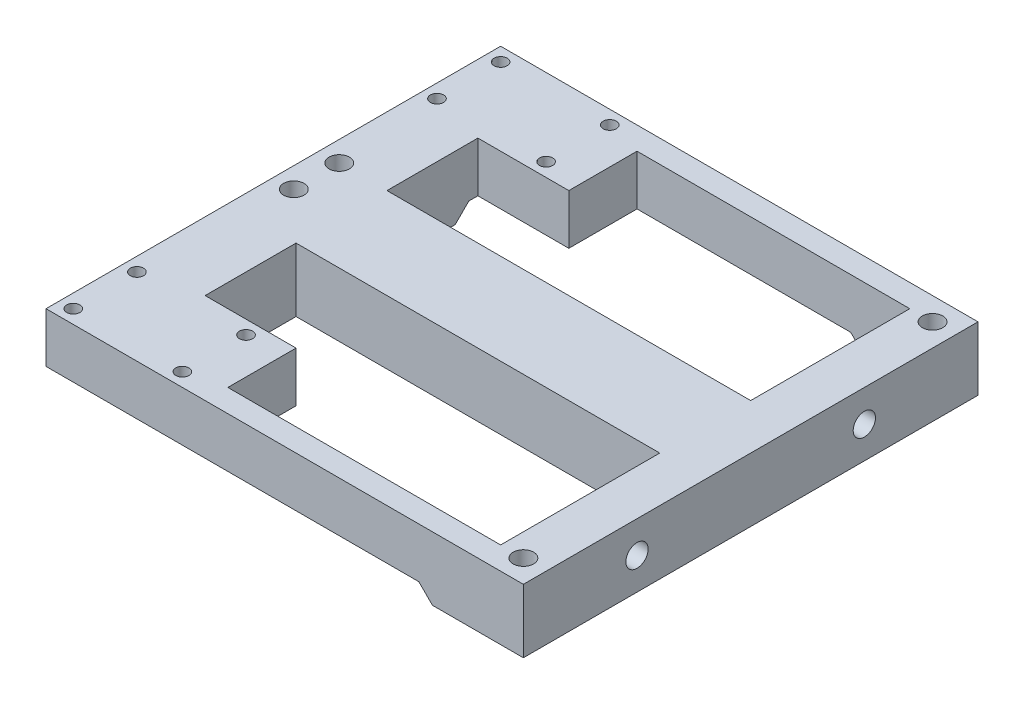
from build123d import *

# Parameters (mm, degrees)
SKETCH_1_W           = 105
SKETCH_1_H           = 100
EXTRUDE_1_DEPTH      = 16
CUT_EXTRUDE_5_REACH  = 147.88
SKETCH_8_R           = 1.45
CUT_EXTRUDE_7_DEPTH  = 146.880087743
SKETCH_9_W           = 35
SKETCH_9_H           = 16
EXTRUDE_2_DEPTH      = 5
SKETCH_10_R          = 2.25
CUT_EXTRUDE_8_DEPTH  = 5
SKETCH_12_W          = 20
SKETCH_12_H          = 16
EXTRUDE_3_DEPTH      = 10
SKETCH_13_R          = 2.25
CUT_EXTRUDE_10_DEPTH = 5
SKETCH_14_W          = 105
SKETCH_14_H          = 100
CUT_EXTRUDE_11_DEPTH = 2
SKETCH_15_R          = 1.5
CUT_EXTRUDE_12_DEPTH = 4
SKETCH_16_W          = 85
SKETCH_16_H          = 25
CUT_EXTRUDE_13_DEPTH = 3
CHAMFER_1_SIZE       = 3
SKETCH_17_R          = 2.25
CUT_EXTRUDE_14_DEPTH = 5
SKETCH_18_R          = 1.5
CUT_EXTRUDE_15_DEPTH = 4
SKETCH_21_R          = 2.45
CUT_EXTRUDE_17_DEPTH = 13.2


with BuildPart() as part:
    # 草图1 → 凸台-拉伸1 (new body)
    with BuildSketch(Plane(origin=(0, 0, 0), x_dir=(1, 0, 0), z_dir=(0, 1, 0))):
        with Locations((-52.5, 50)):
            Rectangle(SKETCH_1_W, SKETCH_1_H)
    extrude(amount=EXTRUDE_1_DEPTH)

    # 草图6 → 切除-拉伸5 (cut, up to next)
    with BuildSketch(Plane(origin=(0, 16, 0), x_dir=(1, 0, 0), z_dir=(0, 1, 0)), mode=Mode.PRIVATE) as cut_extrude_5_sk1:
        Polygon((-45.224064051, 40), (-5, 40), (-5, 5), (-70, 5), (-70, 20), (-100, 20), (-100, 40), align=None)
    cut_extrude_5_tool1 = extrude(cut_extrude_5_sk1.sketch, amount=-CUT_EXTRUDE_5_REACH, mode=Mode.PRIVATE) & part.part
    # 草图6 → 切除-拉伸5 (cut, up to next)
    with BuildSketch(Plane(origin=(0, 16, 0), x_dir=(1, 0, 0), z_dir=(0, 1, 0)), mode=Mode.PRIVATE) as cut_extrude_5_sk2:
        Polygon((-70, 95), (-5, 95), (-5, 60), (-45.224064051, 60), (-100, 60), (-100, 80), (-70, 80), align=None)
    cut_extrude_5_tool2 = extrude(cut_extrude_5_sk2.sketch, amount=-CUT_EXTRUDE_5_REACH, mode=Mode.PRIVATE) & part.part
    add(cut_extrude_5_tool1.solids().sort_by_distance((-47.413043, 16, -24.065217))[0], mode=Mode.SUBTRACT)
    add(cut_extrude_5_tool2.solids().sort_by_distance((-47.413043, 16, -75.934783))[0], mode=Mode.SUBTRACT)

    # 草图8 → 切除-拉伸7 (cut, through all)
    with BuildSketch(Plane(origin=(0, 16, 0), x_dir=(1, 0, 0), z_dir=(0, 1, 0))):
        with Locations(Location((-102, 97, 0), (0, 0, 270))):
            Circle(SKETCH_8_R)
        with Locations(Location((-102, 83, 0), (0, 0, 270))):
            Circle(SKETCH_8_R)
        with Locations(Location((-78, 97, 0), (0, 0, 270))):
            Circle(SKETCH_8_R)
        with Locations(Location((-78, 83, 0), (0, 0, 270))):
            Circle(SKETCH_8_R)
        with Locations(Location((-78, 17, 0), (0, 0, 90))):
            Circle(SKETCH_8_R)
        with Locations(Location((-78, 3, 0), (0, 0, 90))):
            Circle(SKETCH_8_R)
        with Locations(Location((-102, 17, 0), (0, 0, 90))):
            Circle(SKETCH_8_R)
        with Locations(Location((-102, 3, 0), (0, 0, 90))):
            Circle(SKETCH_8_R)
    extrude(amount=-CUT_EXTRUDE_7_DEPTH, mode=Mode.SUBTRACT)

    # 草图9 → 凸台-拉伸2 (add)
    with BuildSketch(Plane.ZY.offset(5)):
        with Locations((-22.5, 8)):
            Rectangle(SKETCH_9_W, SKETCH_9_H)
        with Locations((-77.5, 8)):
            Rectangle(SKETCH_9_W, SKETCH_9_H)
    extrude(amount=EXTRUDE_2_DEPTH)

    # 草图10 → 切除-拉伸8 (cut)
    with BuildSketch(Plane(origin=(0, 16, 0), x_dir=(1, 0, 0), z_dir=(0, 1, 0))):
        with Locations(Location((-5, 95, 0), (0, 0, 270))):
            Circle(SKETCH_10_R)
        with Locations(Location((-5, 5, 0), (0, 0, 90))):
            Circle(SKETCH_10_R)
    extrude(amount=-CUT_EXTRUDE_8_DEPTH, mode=Mode.SUBTRACT)

    # 草图12 → 凸台-拉伸3 (add)
    with BuildSketch(Plane(origin=(-100, 0, 0), x_dir=(0, 0, -1), z_dir=(1, 0, 0))):
        with Locations((30, 8)):
            Rectangle(SKETCH_12_W, SKETCH_12_H)
        with Locations((70, 8)):
            Rectangle(SKETCH_12_W, SKETCH_12_H)
    extrude(amount=EXTRUDE_3_DEPTH)

    # 草图13 → 切除-拉伸10 (cut)
    with BuildSketch(Plane(origin=(0, 16, 0), x_dir=(1, 0, 0), z_dir=(0, 1, 0))):
        with Locations(Location((-100.5, 50, 0), (0, 0, 270))):
            Circle(SKETCH_13_R)
        with Locations(Location((-100.5, 60, 0), (0, 0, 270))):
            Circle(SKETCH_13_R)
    extrude(amount=-CUT_EXTRUDE_10_DEPTH, mode=Mode.SUBTRACT)

    # 草图14 → 切除-拉伸11 (cut)
    with BuildSketch(Plane.XZ):
        with Locations((-52.5, -50)):
            Rectangle(SKETCH_14_W, SKETCH_14_H)
    extrude(amount=-CUT_EXTRUDE_11_DEPTH, mode=Mode.SUBTRACT)

    # 草图15 → 切除-拉伸12 (cut)
    with BuildSketch(Plane(origin=(0, 11, 0), x_dir=(1, 0, 0), z_dir=(0, 1, 0))):
        with Locations(Location((-5, 5, 0), (0, 0, 270))):
            Circle(SKETCH_15_R)
        with Locations(Location((-5, 95, 0), (0, 0, 270))):
            Circle(SKETCH_15_R)
        with Locations(Location((-100.5, 60, 0), (0, 0, 270))):
            Circle(SKETCH_15_R)
        with Locations(Location((-100.5, 50, 0), (0, 0, 270))):
            Circle(SKETCH_15_R)
    extrude(amount=-CUT_EXTRUDE_12_DEPTH, mode=Mode.SUBTRACT)

    # 草图16 → 切除-拉伸13 (cut)
    with BuildSketch(Plane.XZ.offset(-2)):
        with Locations((-62.5, -12.5)):
            Rectangle(SKETCH_16_W, SKETCH_16_H)
        with Locations((-62.5, -87.5)):
            Rectangle(SKETCH_16_W, SKETCH_16_H)
    extrude(amount=-CUT_EXTRUDE_13_DEPTH, mode=Mode.SUBTRACT)

    # 倒角1
    chamfer_1_edges = [part.edges().sort_by_distance(p)[0] for p in [
        (-20, 5, -2.5),
        (-97.5, 5, -25),
        (-97.5, 5, -75),
        (-20, 5, -97.5),
    ]]
    chamfer(chamfer_1_edges, length=CHAMFER_1_SIZE - 0.0001)  # a hair under: the kernel refuses the full size

    # 草图17 → 切除-拉伸14 (cut)
    with BuildSketch(Plane.ZY.offset(105)):
        with Locations((-55.4, 9)):
            Circle(SKETCH_17_R)
    extrude(amount=-CUT_EXTRUDE_14_DEPTH, mode=Mode.SUBTRACT)

    # 草图18 → 切除-拉伸15 (cut)
    with BuildSketch(Plane.ZY.offset(100)):
        with Locations((-55.4, 9)):
            Circle(SKETCH_18_R)
    extrude(amount=-CUT_EXTRUDE_15_DEPTH, mode=Mode.SUBTRACT)

    # 草图21 → 切除-拉伸17 (cut)
    with BuildSketch(Plane(origin=(0, 0, 0), x_dir=(0, 0, -1), z_dir=(1, 0, 0))):
        with Locations((25, 9)):
            Circle(SKETCH_21_R)
        with Locations((75, 9)):
            Circle(SKETCH_21_R)
    extrude(amount=-CUT_EXTRUDE_17_DEPTH, mode=Mode.SUBTRACT)


solid = part.part
